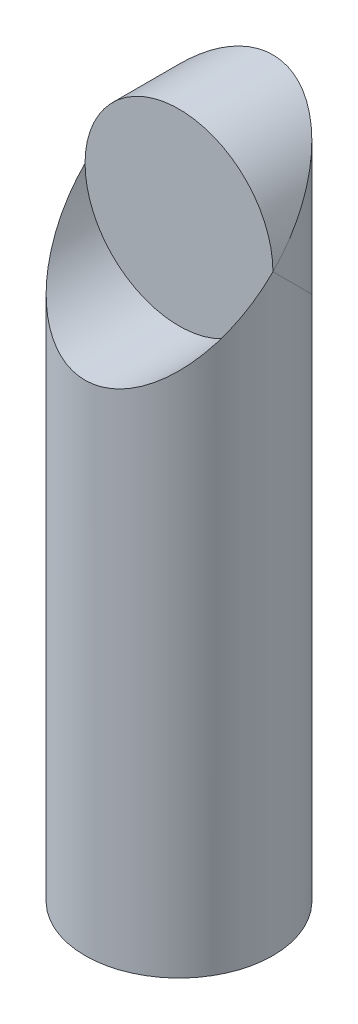
from build123d import *

# Parameters (mm, degrees)
SKETCH1_R                = 23
BOSS_EXTRUDE1_DEPTH      = 145
CUT_EXTRUDE1_DEPTH       = 149.603499286
CUT_EXTRUDE1_DEPTH_BACK  = 149.603499286
SKETCH2_4_R              = 23
BOSS_EXTRUDE3_REACH      = 150.603
BOSS_EXTRUDE3_END_RADIUS = 23
SKETCH2_R                = 23


with BuildPart() as part:
    # Sketch1 → Boss-Extrude1 (new body)
    with BuildSketch(Plane(origin=(0, 0, 0), x_dir=(1, 0, 0), z_dir=(0, 1, 0))):
        Circle(SKETCH1_R)
    extrude(amount=BOSS_EXTRUDE1_DEPTH)

    # Sketch2<4> → Cut-Extrude1 (cut, two sides: drawn at the far end of the back side and taken through both)
    with BuildSketch(Plane.XY.offset(-CUT_EXTRUDE1_DEPTH_BACK)):
        with Locations((0, 145)):
            Circle(SKETCH2_4_R)
    extrude(amount=CUT_EXTRUDE1_DEPTH + CUT_EXTRUDE1_DEPTH_BACK, mode=Mode.SUBTRACT)


with BuildPart() as body_2:
    # Boss-Extrude3: up to this cylinder (the profile starts inside it)
    boss_extrude3_end = Plane(origin=(0, 145, 0), z_dir=(0, -1, 0)) * Cylinder(BOSS_EXTRUDE3_END_RADIUS, 348.206, mode=Mode.PRIVATE)
    # Sketch2 → Boss-Extrude3 (new, up to the surface)
    with BuildSketch(Plane.XY, mode=Mode.PRIVATE) as boss_extrude3_sk1:
        with Locations((0, 145)):
            Circle(SKETCH2_R)
    boss_extrude3_tool1 = extrude(boss_extrude3_sk1.sketch, amount=-BOSS_EXTRUDE3_REACH, mode=Mode.PRIVATE) & boss_extrude3_end
    add(boss_extrude3_tool1.solids().sort_by_distance((0, 145, 0))[0])


solid = Compound([part.part, body_2.part])
